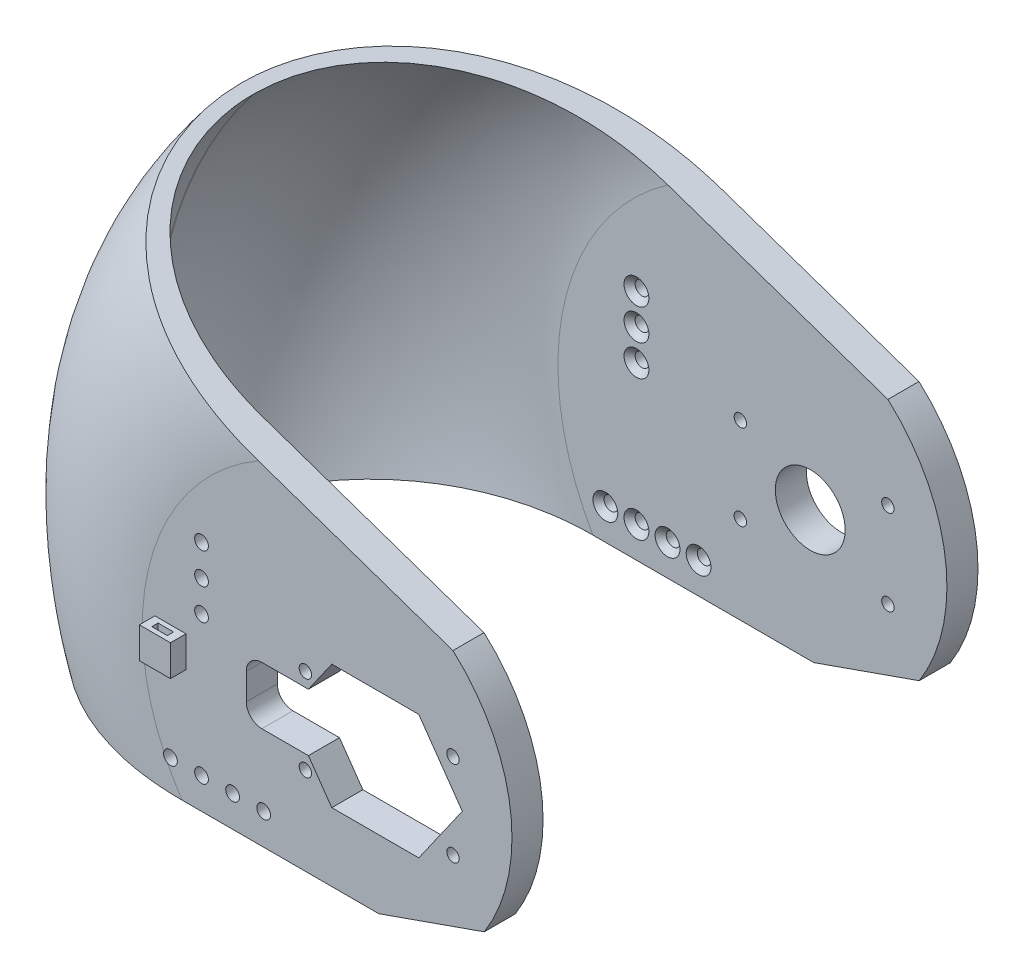
from build123d import *

# Parameters (mm, degrees)
SKETCH1_R                                          = 14.287500000000003
SKETCH1_R_2                                        = 2.5399999999999956
SKETCH1_R_3                                        = 2.54000000000001
BOSS_EXTRUDE1_DEPTH                                = 190.5
CUT_EXTRUDE1_DEPTH                                 = 320.0326288367761
BOSS_EXTRUDE2_DEPTH                                = 165.1
CUT_EXTRUDE3_REACH                                 = 295.934
FILLET2_R                                          = 82.296
FILLET3_R                                          = 95.25
CSK_FOR_10_FLAT_HEAD_MACHINE_SCREW_100_D           = 5.6134
CSK_FOR_10_FLAT_HEAD_MACHINE_SCREW_100_DEPTH       = 20.684649839
CSK_FOR_10_FLAT_HEAD_MACHINE_SCREW_100_CSINK_D     = 10.16
CSK_FOR_10_FLAT_HEAD_MACHINE_SCREW_100_CSINK_ANGLE = 90
SKETCH21_W                                         = 12.699999999999989
SKETCH21_H                                         = 12.699999999999998
BOSS_EXTRUDE4_DEPTH                                = 6.35
CUT_EXTRUDE6_REACH                                 = 263.053


with BuildPart() as part:
    # Sketch1 → Boss-Extrude1 (new body)
    with BuildSketch(Plane.XY):
        with BuildLine():
            Line((1.433766196615992, -53.339999999999996), (-182.88000000000022, -53.339999999999264))
            ThreePointArc((-182.88000000000022, -53.339999999999264), (-187.05078230842932, 36.08676818176672), (-149.91222104231582, 117.54393213671149))
            Line((-149.91222104231582, 117.54393213671149), (31.750000000000515, 54.992613140311555))
            ThreePointArc((31.750000000000515, 54.992613140311555), (55.202024334587925, 10.742736521788927), (44.5517192338911, -38.19211841216))
            Line((44.5517192338911, -38.19211841216), (1.433766196615992, -53.339999999999996))
        make_face()
        Circle(SKETCH1_R, mode=Mode.SUBTRACT)
        with Locations((-28.574999999999996, -17.4625)):
            Circle(SKETCH1_R_2, mode=Mode.SUBTRACT)
        with Locations((-28.57499999999999, 17.4625)):
            Circle(SKETCH1_R_2, mode=Mode.SUBTRACT)
        with Locations((31.75, 17.4625)):
            Circle(SKETCH1_R_3, mode=Mode.SUBTRACT)
        with Locations((31.75, -17.4625)):
            Circle(SKETCH1_R_3, mode=Mode.SUBTRACT)
    extrude(amount=-BOSS_EXTRUDE1_DEPTH)

    # Sketch2 → Cut-Extrude1 (cut, through all)
    with BuildSketch(Plane.XZ.offset(53.33999999999999)):
        Polygon((-190.5, -12.7), (55.88000000000002, -12.699999999999989), (55.88000000000004, -177.79999999999998), (-190.5, -177.79999999999998), align=None)
    extrude(amount=-CUT_EXTRUDE1_DEPTH, mode=Mode.SUBTRACT)


with BuildPart() as cut_extrude1_piece_1:
    # of the separate pieces the step leaves, piece 1, a body of its own (cut_extrude1_pieces)
    add(part.part.solids().sort_by_distance((31.75, 54.99261314, -177.8))[0])



with BuildPart() as cut_extrude1_piece_2:
    # of the separate pieces the step leaves, piece 2, a body of its own (cut_extrude1_pieces)
    add(part.part.solids().sort_by_distance((-149.912221042, 117.543932137, 0))[0])


with BuildPart() as cut_extrude1_piece_1_1:
    add(cut_extrude1_piece_1.part)

    add(cut_extrude1_piece_2.part)  # Boss-Extrude2 merges Cut-Extrude1 piece 2
    # Sketch3 → Boss-Extrude2 (add)
    with BuildSketch(Plane.XY.offset(-177.79999999999998)):
        with BuildLine():
            Line((-149.91222104231636, 117.54393213671082), (-145.1089866782714, 115.89004591206911))
            ThreePointArc((-145.1089866782714, 115.89004591206911), (-182.03990316279737, 35.251609401731216), (-177.79999999999995, -53.34000000000001))
            Line((-177.79999999999995, -53.34000000000001), (-182.88, -53.34000000000002))
            ThreePointArc((-182.88, -53.34000000000002), (-187.05078230842952, 36.08676818176593), (-149.91222104231636, 117.54393213671082))
        make_face()
    extrude(amount=BOSS_EXTRUDE2_DEPTH)

    # Sketch5 → Cut-Extrude3 (cut, up to next)
    with BuildSketch(Plane.XY, mode=Mode.PRIVATE) as cut_extrude3_sk1:
        with BuildLine():
            Line((-17.779999999999998, -25.40000000000005), (17.779999999999998, -25.40000000000005))
            Line((17.779999999999998, -25.40000000000005), (35.56527147052657, -6.53e-15))
            Line((35.56527147052657, -6.53e-15), (17.779999999999944, 25.4))
            Line((17.779999999999944, 25.4), (-17.78000000000005, 25.39999999999995))
            Line((-17.78000000000005, 25.39999999999995), (-27.33958341540813, 11.747499999999972))
            Line((-27.33958341540813, 11.747499999999972), (-46.38958341540802, 11.747499999999865))
            ThreePointArc((-46.38958341540802, 11.747499999999865), (-50.87971147594259, 9.887628060534439), (-52.73958341540801, 5.397499999999867))
            Line((-52.73958341540801, 5.397499999999867), (-52.73958341540802, -5.397500000000032))
            ThreePointArc((-52.73958341540802, -5.397500000000032), (-50.87971147594259, -9.88762806053461), (-46.38958341540802, -11.747500000000032))
            Line((-46.38958341540802, -11.747500000000032), (-27.33958341540801, -11.747500000000036))
            Line((-27.33958341540801, -11.747500000000036), (-17.779999999999998, -25.40000000000005))
        make_face()
    cut_extrude3_tool1 = extrude(cut_extrude3_sk1.sketch, amount=-CUT_EXTRUDE3_REACH, mode=Mode.PRIVATE) & cut_extrude1_piece_1_1.part
    add(cut_extrude3_tool1.solids().sort_by_distance((-6.295319, 0, 0))[0], mode=Mode.SUBTRACT)

    # Fillet2
    fillet2_edges = [cut_extrude1_piece_1_1.edges().sort_by_distance(p)[0] for p in [
        (-182.03990316279737, 35.25160940173124, -12.699999999999989),
        (-182.03990316279737, 35.25160940173124, -177.79999999999998),
    ]]
    fillet(fillet2_edges, radius=FILLET2_R)

    # Fillet3
    fillet3_edges = [cut_extrude1_piece_1_1.edges().sort_by_distance(p)[0] for p in [
        (-187.0507823084293, 36.0867681817667, -190.5),
        (-187.0507823084293, 36.0867681817667, 0),
    ]]
    fillet(fillet3_edges, radius=FILLET3_R - 0.0001)  # a hair under: the kernel refuses the full size

    # CSK for #10 Flat Head Machine Screw (100)12
    with Locations(Plane(origin=(5.4e-16, 0, -12.69999999999999), x_dir=(-1, 0, 0), z_dir=(0, 0, -1))):
        with Locations((83.742381918, -40.64), (71.042381918, 29.21), (71.042381918, 41.91), (71.042381918, 16.51), (58.342381918, -40.64), (71.042381918, -40.64), (45.642381918, -40.64)):
            csk_for_10_flat_head_machine_screw_100 = CounterSinkHole(CSK_FOR_10_FLAT_HEAD_MACHINE_SCREW_100_D / 2, CSK_FOR_10_FLAT_HEAD_MACHINE_SCREW_100_CSINK_D / 2, depth=CSK_FOR_10_FLAT_HEAD_MACHINE_SCREW_100_DEPTH, counter_sink_angle=CSK_FOR_10_FLAT_HEAD_MACHINE_SCREW_100_CSINK_ANGLE)

    # Mirror1: CSK for #10 Flat Head Machine Screw (100)12 across plane
    add(csk_for_10_flat_head_machine_screw_100.mirror(Plane(origin=(2.01e-15, 0, -95.24999999999999), x_dir=(1, 0, 0), z_dir=(0, 0, -1))), mode=Mode.SUBTRACT)

    # Sketch21 → Boss-Extrude4 (add)
    with BuildSketch(Plane.XY):
        with Locations((-83.74238191799974, 0)):
            Rectangle(SKETCH21_W, SKETCH21_H)
    boss_extrude4 = extrude(amount=BOSS_EXTRUDE4_DEPTH)

    # Sketch22 → Cut-Extrude6 (cut, up to next)
    with BuildSketch(Plane(origin=(-83.74238191799974, 6.349999999999994, 0), x_dir=(0, 0, 1), z_dir=(0, -1, 0)), mode=Mode.PRIVATE) as cut_extrude6_sk1:
        Polygon((1.904999999999997, 3.175), (4.444999999999998, 3.175), (4.444999999999998, -3.175), (1.9049999999999987, -3.175), align=None)
    cut_extrude6_tool1 = extrude(cut_extrude6_sk1.sketch, amount=CUT_EXTRUDE6_REACH, mode=Mode.PRIVATE) & cut_extrude1_piece_1_1.part
    cut_extrude6 = cut_extrude6_tool1.solids().sort_by_distance((-83.742382, 6.35, 3.175))[0]
    add(cut_extrude6, mode=Mode.SUBTRACT)

    # Mirror2: Boss-Extrude4, Cut-Extrude6 across plane
    add(boss_extrude4.mirror(Plane(origin=(2.01e-15, 0, -95.24999999999999), x_dir=(1, 0, 0), z_dir=(0, 0, -1))))
    add(cut_extrude6.mirror(Plane(origin=(2.01e-15, 0, -95.24999999999999), x_dir=(1, 0, 0), z_dir=(0, 0, -1))), mode=Mode.SUBTRACT)


solid = cut_extrude1_piece_1_1.part
